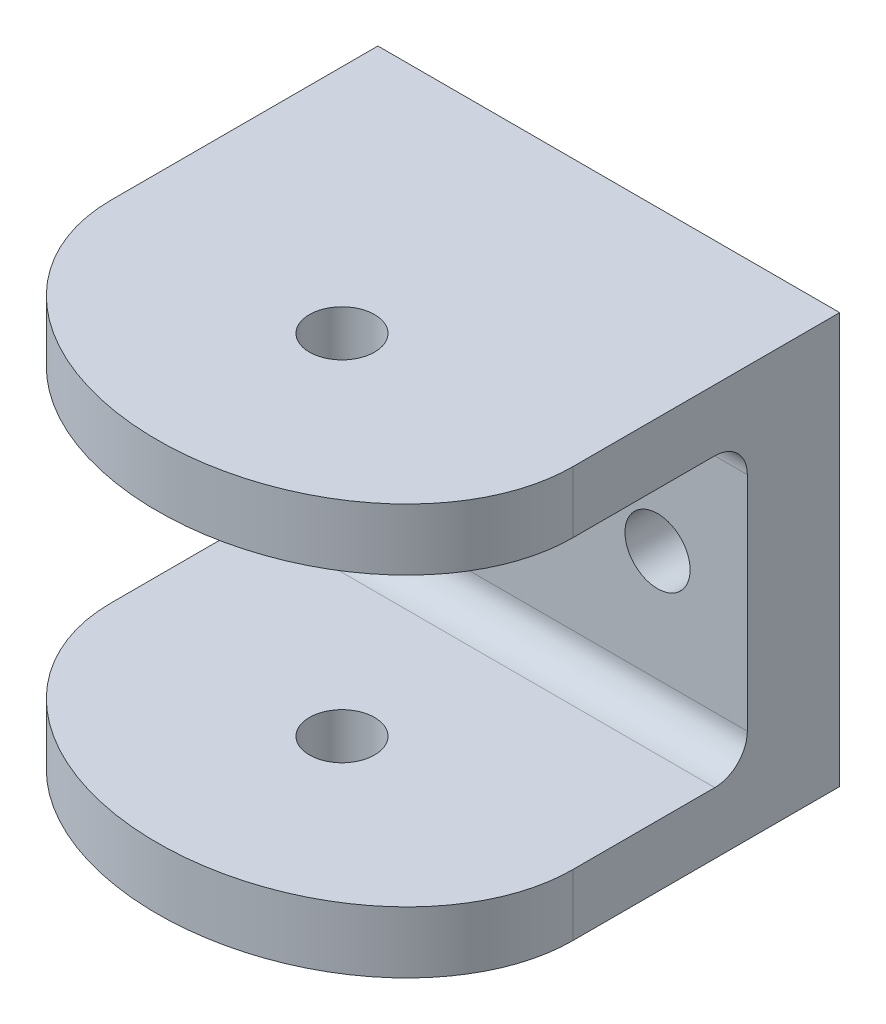
from build123d import *

# Parameters (mm, degrees)
SKETCH1_W           = 45
SKETCH1_H           = 40
SKETCH1_R           = 3.175
BOSS_EXTRUDE1_DEPTH = 9
SKETCH2_W           = 45
SKETCH2_H           = 6
BOSS_EXTRUDE2_DEPTH = 35
FILLET1_R           = 3.175
SKETCH3_R           = 3.175
CUT_EXTRUDE1_DEPTH  = 64.578691399


with BuildPart() as part:
    # Sketch1 → Boss-Extrude1 (new body)
    with BuildSketch(Plane.XY):
        Rectangle(SKETCH1_W, SKETCH1_H)
        with Locations((13.75, 0)):
            Circle(SKETCH1_R, mode=Mode.SUBTRACT)
        with Locations((-13.75, 0)):
            Circle(SKETCH1_R, mode=Mode.SUBTRACT)
    extrude(amount=BOSS_EXTRUDE1_DEPTH)

    # Sketch2 → Boss-Extrude2 (add)
    with BuildSketch(Plane.XY.offset(9)):
        with Locations((0, 17)):
            Rectangle(SKETCH2_W, SKETCH2_H)
        with Locations((0, -17)):
            Rectangle(SKETCH2_W, SKETCH2_H)
    extrude(amount=BOSS_EXTRUDE2_DEPTH)

    # Fillet1
    fillet1_edges = [part.edges().sort_by_distance(p)[0] for p in [
        (0, 14, 9),
        (0, -14, 9),
    ]]
    fillet(fillet1_edges, radius=FILLET1_R)

    # Sketch3 → Cut-Extrude1 (cut, through all)
    with BuildSketch(Plane(origin=(0, 20, 0), x_dir=(1, 0, 0), z_dir=(0, 1, 0))):
        with BuildLine():
            Line((2.1e-08, -44), (22.5, -44))
            Line((22.5, -44), (22.5, -26))
            add(Edge.make_bspline(
                [(2.1e-08, -44), (7.18194944, -43.99999985), (13.035725248, -40.671220377), (22.499999707, -35.289312428), (22.5, -26)],
                knots=[1.530551806, 1.530551806, 1.530551806, 2.188746376, 2.188746376, 3.155795238, 3.155795238, 3.155795238], degree=2, weights=[0.77230325, 0.837192562, 1, 0.76079604, 0.732965969]))
        make_face()
        with BuildLine():
            Line((-22.5, -44), (2.1e-08, -44))
            add(Edge.make_bspline(
                [(-22.5, -26.00000126), (-22.499998992, -44.000000471), (2.1e-08, -44)],
                knots=[0, 0, 0, 1.530551806, 1.530551806, 1.530551806], degree=2, weights=[1, 0.621411009, 0.77230325]))
            Line((-22.5, -26.00000126), (-22.5, -44))
        make_face()
        with Locations((0, -26)):
            Circle(SKETCH3_R)
    extrude(amount=-CUT_EXTRUDE1_DEPTH, mode=Mode.SUBTRACT)


solid = part.part
